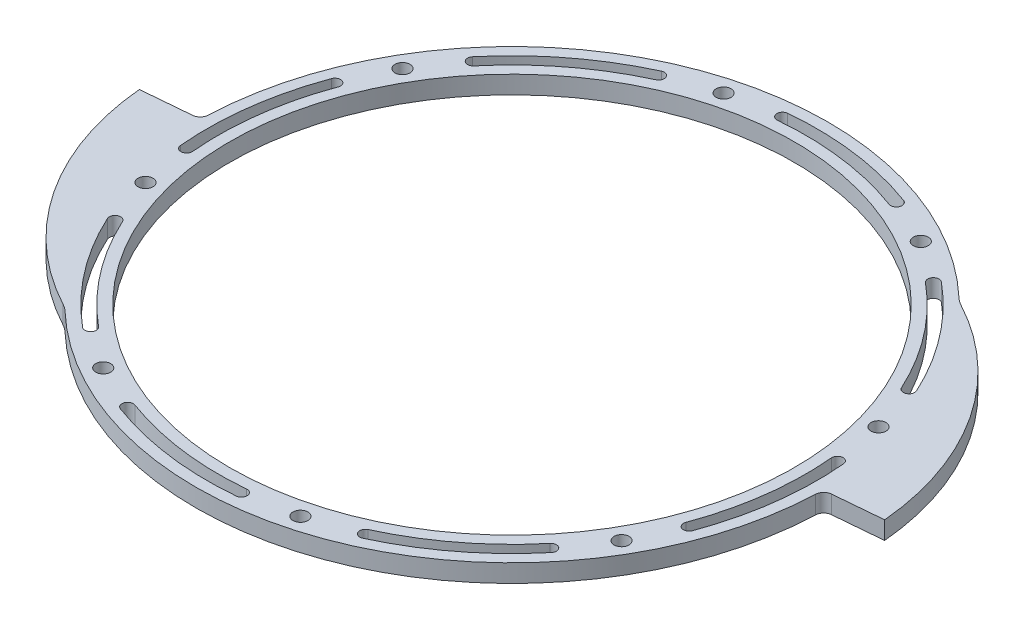
from build123d import *

# Parameters (mm, degrees)
SKETCH1_R                = 100
BOSS_EXTRUDE1_DEPTH      = 3.175
FILLET1_R                = 3
CIRPATTERN1_COUNT        = 2
FILLET1_OF_CIRPATTERN1_R = 3
SKETCH2_R                = 2.65
CUT_EXTRUDE1_DEPTH       = 174.229104079
CIRPATTERN2_COUNT        = 8
LIGHTENING_CUT_DEPTH     = 174.229104079
LIGHTENING_PATTERN_COUNT = 8


with BuildPart() as part:
    # Sketch1 → Boss-Extrude1 (new, symmetric)
    with BuildSketch(Plane(origin=(0, 0, 0), x_dir=(1, 0, 0), z_dir=(0, 1, 0))):
        with BuildLine():
            Line((-111.986312116, 1.750970805), (-132, 0))
            ThreePointArc((-132, 0), (-115.815804966, -46.398149165), (-79.477414809, -79.477414809))
            ThreePointArc((-79.477414809, -79.477414809), (-78.32708198, -80.19539315), (-77.284459499, -81.062397694))
            ThreePointArc((-77.284459499, -81.062397694), (103.297481806, 43.285450818), (-111.986312116, 1.750970805))
        make_face()
        Circle(SKETCH1_R, mode=Mode.SUBTRACT)
    boss_extrude1 = extrude(amount=BOSS_EXTRUDE1_DEPTH, both=True)

    # Fillet1
    fillet1_edges = [part.edges().sort_by_distance(p)[0] for p in [
        (-111.986312116, 0, -1.750970805),
    ]]
    fillet(fillet1_edges, radius=FILLET1_R)

    # CirPattern1: Boss-Extrude1 ×2 about axis
    cirpattern1_axis = Axis((0, 3.175, 0), (0, -1, 0))
    for i in range(1, CIRPATTERN1_COUNT):
        add(boss_extrude1.rotate(cirpattern1_axis, i * 360 / CIRPATTERN1_COUNT))

    # Fillet1 of CirPattern1
    fillet1_of_cirpattern1_edges = [part.edges().sort_by_distance(p)[0] for p in [
        (111.986312116, 0, 1.750970805),
    ]]
    fillet(fillet1_of_cirpattern1_edges, radius=FILLET1_OF_CIRPATTERN1_R)

    # Sketch2 → Cut-Extrude1 (cut, through all)
    with BuildSketch(Plane(origin=(0, 3.175, 0), x_dir=(1, 0, 0), z_dir=(0, 1, 0))):
        with Locations((-102.388137587, -27.434818781)):
            Circle(SKETCH2_R)
    cut_extrude1 = extrude(amount=-CUT_EXTRUDE1_DEPTH, mode=Mode.SUBTRACT)

    # CirPattern2: Cut-Extrude1 ×8 about axis
    cirpattern2_axis = Axis((0, 3.175, 0), (0, -1, 0))
    for i in range(1, CIRPATTERN2_COUNT):
        add(cut_extrude1.rotate(cirpattern2_axis, i * 360 / CIRPATTERN2_COUNT), mode=Mode.SUBTRACT)

    # Sketch3 → Lightening Cut (cut, through all)
    with BuildSketch(Plane(origin=(0, 3.175, 0), x_dir=(1, 0, 0), z_dir=(0, 1, 0))):
        with BuildLine():
            ThreePointArc((-101.318921825, 37.396204088), (-107.076045028, 14.09682876), (-107.545413115, -9.898692736))
            ThreePointArc((-107.545413115, -9.898692736), (-105.370522266, -11.706965335), (-103.562249667, -9.532074486))
            ThreePointArc((-103.562249667, -9.532074486), (-103.110265583, 13.574723991), (-97.566369165, 36.011159492))
            ThreePointArc((-97.566369165, 36.011159492), (-98.750123197, 38.57995812), (-101.318921825, 37.396204088))
        make_face()
    lightening_cut = extrude(amount=-LIGHTENING_CUT_DEPTH, mode=Mode.SUBTRACT)

    # Lightening Pattern: Lightening Cut ×8 about axis
    lightening_pattern_axis = Axis((0, 3.175, 0), (0, -1, 0))
    for i in range(1, LIGHTENING_PATTERN_COUNT):
        add(lightening_cut.rotate(lightening_pattern_axis, i * 360 / LIGHTENING_PATTERN_COUNT), mode=Mode.SUBTRACT)


solid = part.part
